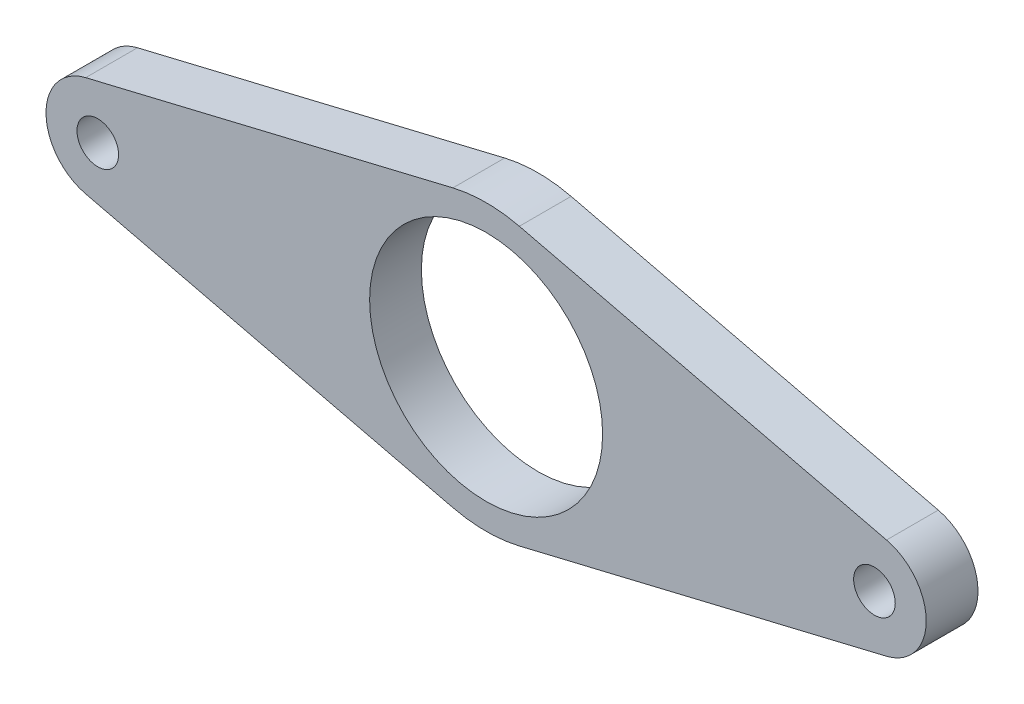
from build123d import *

# Parameters (mm, degrees)
SKETCH1_R           = 2.5527
SKETCH1_R_2         = 14.2875
BOSS_EXTRUDE1_DEPTH = 6.35


with BuildPart() as part:
    # Sketch1 → Boss-Extrude1 (new body)
    with BuildSketch(Plane.XY):
        with BuildLine():
            Line((-4.074583333, 16.98047929), (-49.106666667, 6.174719742))
            ThreePointArc((-49.106666667, 6.174719742), (-53.975, 0), (-49.106666667, -6.174719742))
            Line((-49.106666667, -6.174719742), (-4.074583333, -16.98047929))
            ThreePointArc((-4.074583333, -16.98047929), (0, -17.4625), (4.074583333, -16.98047929))
            Line((4.074583333, -16.98047929), (49.106666667, -6.174719742))
            ThreePointArc((49.106666667, -6.174719742), (53.975, 0), (49.106666667, 6.174719742))
            Line((49.106666667, 6.174719742), (4.074583333, 16.98047929))
            ThreePointArc((4.074583333, 16.98047929), (0, 17.4625), (-4.074583333, 16.98047929))
        make_face()
        with Locations((-47.625, 0)):
            Circle(SKETCH1_R, mode=Mode.SUBTRACT)
        Circle(SKETCH1_R_2, mode=Mode.SUBTRACT)
        with Locations((47.625, 0)):
            Circle(SKETCH1_R, mode=Mode.SUBTRACT)
    extrude(amount=BOSS_EXTRUDE1_DEPTH)


solid = part.part
